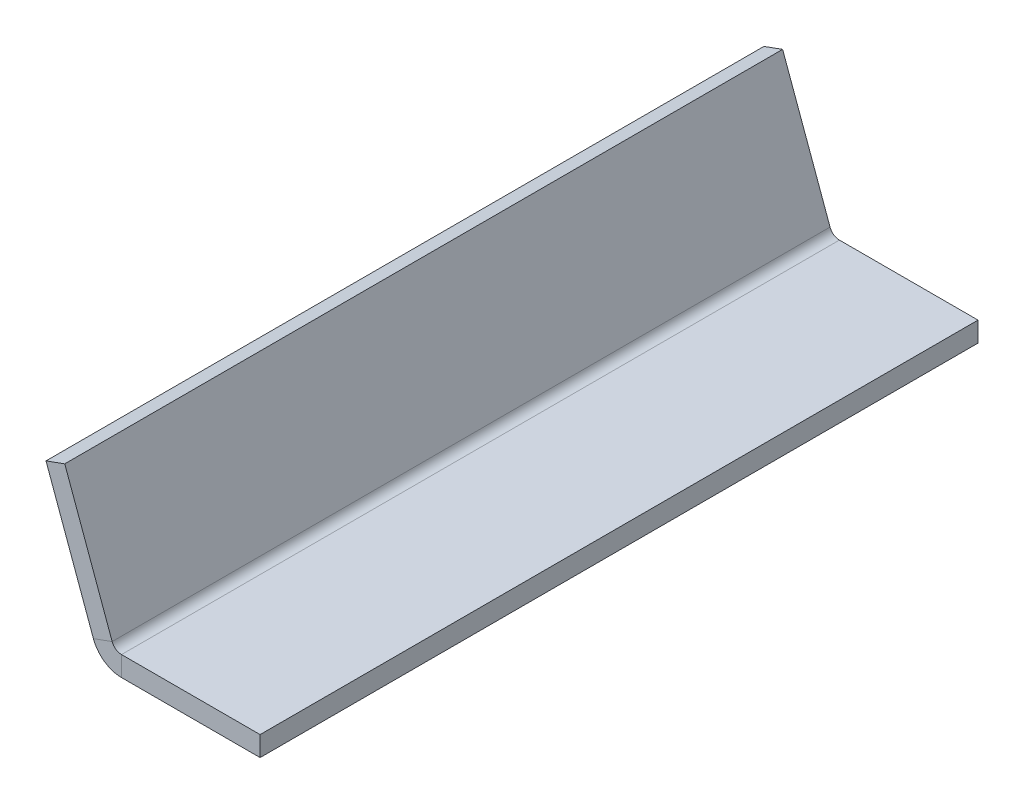
from build123d import *

# Parameters (mm, degrees)
T_LE_DE_BASE_PLI_E1_DEPTH = 360


# Sheet-metal steps are written as plain solids
with BuildPart() as part:
    # Esquisse1 → Tôle de base pliée1 (new body)
    with BuildSketch(Plane.XY):
        with BuildLine():
            Line((-27.361611466, 75.175409663), (-3.592276239, 9.86969785))
            ThreePointArc((-3.592276239, 9.86969785), (1.899466528, 2.712719336), (10.503113073, 0))
            Line((10.503113073, 0), (80, 0))
            Line((80, 0), (80, 10))
            Line((80, 10), (10.503113073, 10))
            ThreePointArc((10.503113073, 10), (7.635230891, 10.904239779), (5.804649969, 13.289899283))
            Line((5.804649969, 13.289899283), (-17.964685258, 78.595611096))
            Line((-17.964685258, 78.595611096), (-27.361611466, 75.175409663))
        make_face()
    extrude(amount=T_LE_DE_BASE_PLI_E1_DEPTH)


solid = part.part
